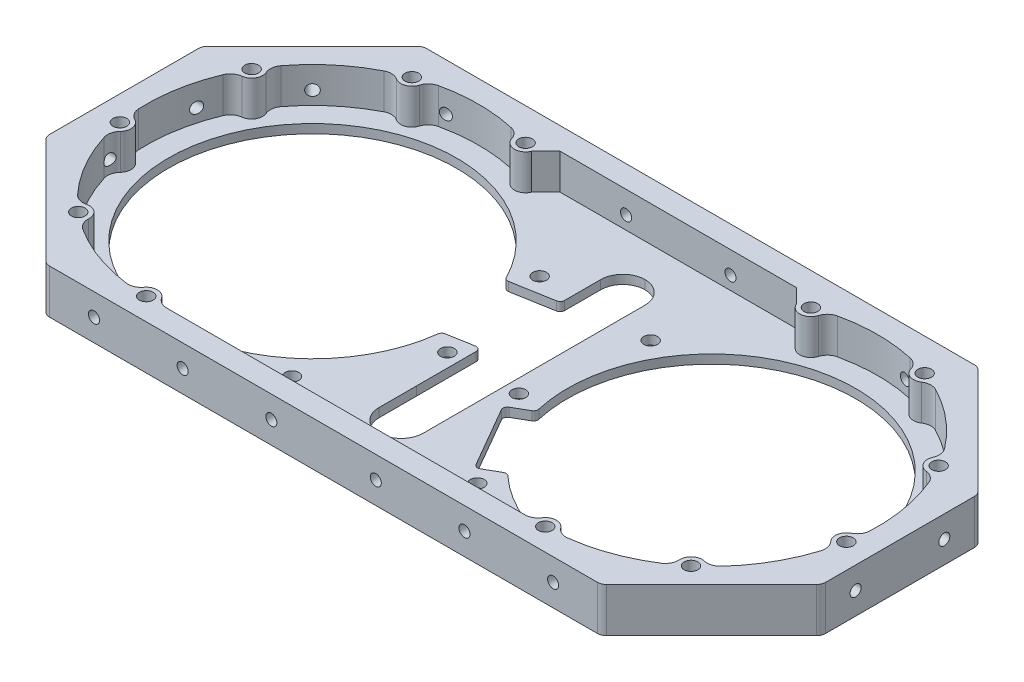
from build123d import *

# Parameters (mm, degrees)
SKETCH_2_R             = 1.55
SKETCH_2_R_2           = 1.550000002
SKETCH_2_R_3           = 1.550000001
EXTRUDE_3_DEPTH        = 10
SKETCH_2_8_W           = 10
SKETCH_2_8_H           = 60
SKETCH_2_8_R           = 1.55
SKETCH_2_8_R_2         = 1.550000002
SKETCH_2_8_R_3         = 1.550000001
SKETCH_2_8_R_4         = 32.5
EXTRUDE_4_DEPTH        = 2
CUT_EXTRUDE_1_DEPTH    = 12
FILLET_4_R             = 1
EXTRUDE_5_DEPTH        = 8
FILLET_5_R             = 3
FILLET_6_R             = 3
FILLET_7_R             = 2
HOLE_WIZARD_M3_1_D     = 2.5
HOLE_WIZARD_M3_1_DEPTH = 7.5
HOLE_WIZARD_M3_1_TIP   = 0.751075774
HOLE_WIZARD_M3_3_D     = 2.5
HOLE_WIZARD_M3_3_DEPTH = 8.5
HOLE_WIZARD_M3_3_TIP   = 0.751075774
HOLE_WIZARD_M3_4_D     = 2.5
HOLE_WIZARD_M3_4_DEPTH = 8.5
HOLE_WIZARD_M3_4_TIP   = 0.751075774
HOLE_WIZARD_M3_5_D     = 2.5
HOLE_WIZARD_M3_5_DEPTH = 8.5
HOLE_WIZARD_M3_5_TIP   = 0.751075774
FILLET_8_R             = 5
HOLE_WIZARD_M3_7_D     = 2.5
HOLE_WIZARD_M3_7_DEPTH = 8.5
HOLE_WIZARD_M3_7_TIP   = 0.751075774
HOLE_WIZARD_M3_8_D     = 2.5
HOLE_WIZARD_M3_8_DEPTH = 8.5
HOLE_WIZARD_M3_8_TIP   = 0.751075774


with BuildPart() as part:
    # 草图2 → 凸台-拉伸3 (new body)
    with BuildSketch(Plane(origin=(0, 0, 0), x_dir=(1, 0, 0), z_dir=(0, 1, 0))):
        Polygon((-17.604076401, 42.5), (-42.5, 17.604076401), (-42.5, -17.604076401), (-17.604076401, -42.5), (107.604076401, -42.5), (132.5, -17.604076401), (132.5, 17.604076401), (107.604076401, 42.5), align=None)
        with BuildLine():
            Line((15.145179759, 34.305590362), (20.839589397, 40))
            Line((20.839589397, 40), (69.160410606, 40))
            Line((69.160410606, 40), (74.854820243, 34.305590363))
            ThreePointArc((74.854820243, 34.305590363), (78.029294984, 32.889241728), (79.550672364, 36.014740759))
            ThreePointArc((79.550672364, 36.014740759), (90, 37.5), (100.449327636, 36.014740759))
            ThreePointArc((100.449327636, 36.014740759), (101.970705016, 32.889241728), (105.145179757, 34.305590363))
            ThreePointArc((105.145179757, 34.305590363), (114.104535363, 28.726666617), (121.154478496, 20.872193695))
            ThreePointArc((121.154478496, 20.872193695), (120.310889132, 17.5), (123.653089221, 16.544472971))
            ThreePointArc((123.653089221, 16.544472971), (126.930290738, 6.511806663), (127.282102624, -4.036684767))
            ThreePointArc((127.282102624, -4.036684767), (124.468271355, -6.077686218), (126.414344226, -8.957987195))
            ThreePointArc((126.414344226, -8.957987195), (122.475952642, -18.75), (115.965016591, -27.056753565))
            ThreePointArc((115.965016591, -27.056753565), (112.497566339, -26.811555509), (112.136922868, -30.268905596))
            ThreePointArc((112.136922868, -30.268905596), (102.825755375, -35.238473279), (92.498610725, -37.416666667))
            ThreePointArc((92.498610725, -37.416666667), (89.958327543, -35.000347343), (87.5, -37.5))
            Line((87.5, -37.5), (2.5, -37.5))
            ThreePointArc((2.5, -37.5), (0.041672457, -35.000347343), (-2.498610725, -37.416666667))
            ThreePointArc((-2.498610725, -37.416666667), (-12.825755375, -35.23847328), (-22.136922867, -30.268905596))
            ThreePointArc((-22.136922867, -30.268905596), (-22.497566338, -26.811555509), (-25.96501659, -27.056753565))
            ThreePointArc((-25.96501659, -27.056753565), (-32.475952642, -18.75), (-36.414344226, -8.957987195))
            ThreePointArc((-36.414344226, -8.957987195), (-34.468271354, -6.077686218), (-37.282102624, -4.036684767))
            ThreePointArc((-37.282102624, -4.036684767), (-36.930290738, 6.511806663), (-33.65308922, 16.544472972))
            ThreePointArc((-33.65308922, 16.544472972), (-30.31088913, 17.5), (-31.154478495, 20.872193696))
            ThreePointArc((-31.154478495, 20.872193696), (-24.104535362, 28.726666618), (-15.145179755, 34.305590363))
            ThreePointArc((-15.145179755, 34.305590363), (-11.970705014, 32.889241727), (-10.449327634, 36.01474076))
            ThreePointArc((-10.449327634, 36.01474076), (2e-09, 37.5), (10.449327638, 36.014740759))
            ThreePointArc((10.449327638, 36.014740759), (11.970705018, 32.889241726), (15.145179759, 34.305590362))
        make_face(mode=Mode.SUBTRACT)
        with Locations(Location((126.930290738, -6.511806663, 0), (0, 0, 270))):
            Circle(SKETCH_2_R, mode=Mode.SUBTRACT)
        with Locations(Location((122.475952642, 18.75, 0), (0, 0, 270))):
            Circle(SKETCH_2_R, mode=Mode.SUBTRACT)
        with Locations(Location((90, -37.5, 0), (0, 0, 270))):
            Circle(SKETCH_2_R, mode=Mode.SUBTRACT)
        with Locations(Location((-24.104535363, -28.726666616, 0), (0, 0, 270))):
            Circle(SKETCH_2_R, mode=Mode.SUBTRACT)
        with Locations(Location((0, -37.5, 0), (0, 0, 270))):
            Circle(SKETCH_2_R, mode=Mode.SUBTRACT)
        with Locations(Location((12.825755377, 35.238473278, 0), (0, 0, 270))):
            Circle(SKETCH_2_R_2, mode=Mode.SUBTRACT)
        with Locations(Location((-12.825755372, 35.238473279, 0), (0, 0, 270))):
            Circle(SKETCH_2_R_3, mode=Mode.SUBTRACT)
        with Locations(Location((-32.47595264, 18.75, 0), (0, 0, 270))):
            Circle(SKETCH_2_R, mode=Mode.SUBTRACT)
        with Locations(Location((77.174244625, 35.238473279, 0), (0, 0, 270))):
            Circle(SKETCH_2_R, mode=Mode.SUBTRACT)
        with Locations(Location((102.825755375, 35.238473279, 0), (0, 0, 270))):
            Circle(SKETCH_2_R, mode=Mode.SUBTRACT)
        with Locations(Location((-36.930290736, -6.511806662, 0), (0, 0, 270))):
            Circle(SKETCH_2_R, mode=Mode.SUBTRACT)
        with Locations(Location((114.104535363, -28.726666617, 0), (0, 0, 270))):
            Circle(SKETCH_2_R, mode=Mode.SUBTRACT)
    extrude(amount=EXTRUDE_3_DEPTH)

    # 草图2<8> → 凸台-拉伸4 (add)
    with BuildSketch(Plane(origin=(0, 0, 0), x_dir=(1, 0, 0), z_dir=(0, 1, 0))):
        with BuildLine():
            Line((20.839589397, 40), (15.145179759, 34.305590362))
            ThreePointArc((15.145179759, 34.305590362), (11.970705018, 32.889241726), (10.449327638, 36.014740759))
            ThreePointArc((10.449327638, 36.014740759), (2e-09, 37.5), (-10.449327634, 36.01474076))
            ThreePointArc((-10.449327634, 36.01474076), (-11.970705014, 32.889241727), (-15.145179755, 34.305590363))
            ThreePointArc((-15.145179755, 34.305590363), (-24.104535362, 28.726666618), (-31.154478495, 20.872193696))
            ThreePointArc((-31.154478495, 20.872193696), (-30.31088913, 17.5), (-33.65308922, 16.544472972))
            ThreePointArc((-33.65308922, 16.544472972), (-36.930290738, 6.511806663), (-37.282102624, -4.036684767))
            ThreePointArc((-37.282102624, -4.036684767), (-34.468271354, -6.077686218), (-36.414344226, -8.957987195))
            ThreePointArc((-36.414344226, -8.957987195), (-32.475952642, -18.75), (-25.96501659, -27.056753565))
            ThreePointArc((-25.96501659, -27.056753565), (-22.497566338, -26.811555509), (-22.136922867, -30.268905596))
            ThreePointArc((-22.136922867, -30.268905596), (-12.825755375, -35.23847328), (-2.498610725, -37.416666667))
            ThreePointArc((-2.498610725, -37.416666667), (0.041672457, -35.000347343), (2.5, -37.5))
            Line((2.5, -37.5), (87.5, -37.5))
            ThreePointArc((87.5, -37.5), (89.958327543, -35.000347343), (92.498610725, -37.416666667))
            ThreePointArc((92.498610725, -37.416666667), (102.825755375, -35.238473279), (112.136922868, -30.268905596))
            ThreePointArc((112.136922868, -30.268905596), (112.497566339, -26.811555509), (115.965016591, -27.056753565))
            ThreePointArc((115.965016591, -27.056753565), (122.475952642, -18.75), (126.414344226, -8.957987195))
            ThreePointArc((126.414344226, -8.957987195), (124.468271355, -6.077686218), (127.282102624, -4.036684767))
            ThreePointArc((127.282102624, -4.036684767), (126.930290738, 6.511806663), (123.653089221, 16.544472971))
            ThreePointArc((123.653089221, 16.544472971), (120.310889132, 17.5), (121.154478496, 20.872193695))
            ThreePointArc((121.154478496, 20.872193695), (114.104535363, 28.726666617), (105.145179757, 34.305590363))
            ThreePointArc((105.145179757, 34.305590363), (101.970705016, 32.889241728), (100.449327636, 36.014740759))
            ThreePointArc((100.449327636, 36.014740759), (90, 37.5), (79.550672364, 36.014740759))
            ThreePointArc((79.550672364, 36.014740759), (78.029294984, 32.889241728), (74.854820243, 34.305590363))
            Line((74.854820243, 34.305590363), (69.160410606, 40))
            Line((69.160410606, 40), (20.839589397, 40))
        make_face()
        with Locations((45, 0)):
            Rectangle(SKETCH_2_8_W, SKETCH_2_8_H, mode=Mode.SUBTRACT)
        with Locations(Location((65.895464637, -28.726666617, 0), (0, 0, 270))):
            Circle(SKETCH_2_8_R, mode=Mode.SUBTRACT)
        with Locations(Location((53.069709262, -6.511806663, 0), (0, 0, 270))):
            Circle(SKETCH_2_8_R, mode=Mode.SUBTRACT)
        with Locations(Location((57.524047358, 18.75, 0), (0, 0, 270))):
            Circle(SKETCH_2_8_R, mode=Mode.SUBTRACT)
        with Locations(Location((32.475952643, 18.749999998, 0), (0, 0, 270))):
            Circle(SKETCH_2_8_R_2, mode=Mode.SUBTRACT)
        with Locations(Location((36.930290738, -6.511806664, 0), (0, 0, 270))):
            Circle(SKETCH_2_8_R_2, mode=Mode.SUBTRACT)
        with Locations(Location((24.104535363, -28.726666618, 0), (0, 0, 270))):
            Circle(SKETCH_2_8_R_3, mode=Mode.SUBTRACT)
        with Locations(Location((0, 0, 0), (0, 0, 270))):
            Circle(SKETCH_2_8_R_4, mode=Mode.SUBTRACT)
        with Locations(Location((90, 0, 0), (0, 0, 270))):
            Circle(SKETCH_2_8_R_4, mode=Mode.SUBTRACT)
    extrude(amount=EXTRUDE_4_DEPTH)

    # 草图3 → 切除-拉伸1 (cut)
    with BuildSketch(Plane(origin=(0, 2, 0), x_dir=(1, 0, 0), z_dir=(0, 1, 0))):
        Polygon((37.762150046, -2.303420976), (34.696997373, 15.079923662), (26.818535348, 13.690738241), (29.883688022, -3.692606397), align=None)
        Polygon((60.655573116, -6.750908278), (53.727369886, -10.750908278), (62.553125261, -26.037565002), (69.481328491, -22.037565002), align=None)
        Polygon((40, 16.014986103), (34.696997373, 15.079923662), (37.762150046, -2.303420976), (40, -1.908827651), align=None)
        Polygon((42.575459397, 16.469109083), (40, 16.014986103), (40, -1.908827651), (45.640612071, -0.914235555), align=None)
    extrude(amount=-CUT_EXTRUDE_1_DEPTH, mode=Mode.SUBTRACT)

    # 圆角4
    fillet_4_edges = [part.edges().sort_by_distance(p)[0] for p in [
        (29.270913687, 1, -14.123158709),
        (32.336066361, 1, 3.260185929),
        (67.324743171, 1, 23.282670117),
        (58.498987797, 1, 7.996013392),
        (62.553125261, 1, 26.037565002),
        (53.727369886, 1, 10.750908278),
        (40, 1, -16.014986103),
        (40, 1, 1.908827651),
    ]]
    fillet(fillet_4_edges, radius=FILLET_4_R)

    # 草图4 → 凸台-拉伸5 (add)
    with BuildSketch(Plane(origin=(0, 2, 0), x_dir=(1, 0, 0), z_dir=(0, 1, 0))):
        Polygon((20.839589397, 40), (18.339589397, 37.5), (71.660410606, 37.5), (69.160410606, 40), align=None)
    extrude(amount=EXTRUDE_5_DEPTH)

    # 圆角5
    fillet_5_edges = [part.edges().sort_by_distance(p)[0] for p in [
        (92.498610725, 6, 37.416666667),
        (112.136922868, 6, 30.268905596),
        (115.965016591, 6, 27.056753565),
        (126.414344226, 6, 8.957987195),
        (127.282102624, 6, 4.036684767),
        (123.653089221, 6, -16.544472971),
        (121.154478496, 6, -20.872193695),
        (105.145179757, 6, -34.305590363),
        (100.449327636, 6, -36.014740759),
        (79.550672364, 6, -36.014740759),
        (10.449327638, 6, -36.014740759),
        (-10.449327634, 6, -36.01474076),
        (-15.145179755, 6, -34.305590363),
        (-31.154478495, 6, -20.872193696),
        (-33.65308922, 6, -16.544472972),
        (-37.282102624, 6, 4.036684767),
        (-36.414344226, 6, 8.957987195),
        (-25.96501659, 6, 27.056753565),
        (-22.136922867, 6, 30.268905596),
        (-2.498610725, 6, 37.416666667),
        (2.5, 6, 37.5),
    ]]
    fillet(fillet_5_edges, radius=FILLET_5_R)

    # 圆角6
    fillet_6_edges = [part.edges().sort_by_distance(p)[0] for p in [
        (87.5, 6, 37.5),
    ]]
    fillet(fillet_6_edges, radius=FILLET_6_R)

    # 圆角7
    fillet_7_edges = [part.edges().sort_by_distance(p)[0] for p in [
        (107.604076401, 5, -42.5),
        (132.5, 5, -17.604076401),
        (132.5, 5, 17.604076401),
        (107.604076401, 5, 42.5),
        (-17.604076401, 5, 42.5),
        (-42.5, 5, 17.604076401),
        (-42.5, 5, -17.604076401),
        (-17.604076401, 5, -42.5),
    ]]
    fillet(fillet_7_edges, radius=FILLET_7_R)

    # M3 螺纹孔1
    with Locations(Plane(origin=(0, 0, -42.5), x_dir=(-1, 0, 0), z_dir=(0, 0, -1))):
        with Locations((-96.775649276, 5), (-76.775649276, 5), (-56.775649276, 5), (-13.224350724, 5), (6.775649276, 5), (-33.224350724, 5)):
            Hole(HOLE_WIZARD_M3_1_D / 2, depth=HOLE_WIZARD_M3_1_DEPTH)
            with Locations((0, 0, -(HOLE_WIZARD_M3_1_DEPTH + HOLE_WIZARD_M3_1_TIP / 2))):  # 118° drill point
                Cone(0, HOLE_WIZARD_M3_1_D / 2, HOLE_WIZARD_M3_1_TIP, mode=Mode.SUBTRACT)

    # M3 螺纹孔3
    with Locations(Plane(origin=(-6.775649276, 5, 42.5), x_dir=(1, 0, 0), z_dir=(0, 0, 1))):
        with Locations((0, 0), (20, 0), (40, 0), (63.551298552, 0), (83.551298552, 0), (103.551298552, 0)):
            Hole(HOLE_WIZARD_M3_3_D / 2, depth=HOLE_WIZARD_M3_3_DEPTH)
            with Locations((0, 0, -(HOLE_WIZARD_M3_3_DEPTH + HOLE_WIZARD_M3_3_TIP / 2))):  # 118° drill point
                Cone(0, HOLE_WIZARD_M3_3_D / 2, HOLE_WIZARD_M3_3_TIP, mode=Mode.SUBTRACT)

    # M3 螺纹孔4
    with Locations(Plane(origin=(132.5, 5, 10), x_dir=(0, 0, 1), z_dir=(1, 0, 0))):
        with Locations((0, 0), (-20, 0)):
            Hole(HOLE_WIZARD_M3_4_D / 2, depth=HOLE_WIZARD_M3_4_DEPTH)
            with Locations((0, 0, -(HOLE_WIZARD_M3_4_DEPTH + HOLE_WIZARD_M3_4_TIP / 2))):  # 118° drill point
                Cone(0, HOLE_WIZARD_M3_4_D / 2, HOLE_WIZARD_M3_4_TIP, mode=Mode.SUBTRACT)

    # M3 螺纹孔5
    with Locations(Plane(origin=(-42.5, 5, -10), x_dir=(0, 0, -1), z_dir=(-1, 0, 0))):
        with Locations((0, 0), (-20, 0)):
            Hole(HOLE_WIZARD_M3_5_D / 2, depth=HOLE_WIZARD_M3_5_DEPTH)
            with Locations((0, 0, -(HOLE_WIZARD_M3_5_DEPTH + HOLE_WIZARD_M3_5_TIP / 2))):  # 118° drill point
                Cone(0, HOLE_WIZARD_M3_5_D / 2, HOLE_WIZARD_M3_5_TIP, mode=Mode.SUBTRACT)

    # 圆角8
    fillet_8_edges = [part.edges().sort_by_distance(p)[0] for p in [
        (40, 1, 30),
        (50, 1, 30),
        (50, 1, -30),
        (40, 1, -30),
    ]]
    fillet(fillet_8_edges, radius=FILLET_8_R - 0.0001)  # a hair under: the kernel refuses the full size

    # M3 螺纹孔7
    with Locations(Plane(origin=(-30.0520382, 5, -30.0520382), x_dir=(-0.707106781187, 0, 0.707106781187), z_dir=(-0.707106781187, 0, -0.707106781187))):
        with Locations((0, 0)):
            Hole(HOLE_WIZARD_M3_7_D / 2, depth=HOLE_WIZARD_M3_7_DEPTH)
            with Locations((0, 0, -(HOLE_WIZARD_M3_7_DEPTH + HOLE_WIZARD_M3_7_TIP / 2))):  # 118° drill point
                Cone(0, HOLE_WIZARD_M3_7_D / 2, HOLE_WIZARD_M3_7_TIP, mode=Mode.SUBTRACT)

    # M3 螺纹孔8
    with Locations(Plane(origin=(120.0520382, 5, -30.0520382), x_dir=(0.707106781187, 0, 0.707106781187), z_dir=(0.707106781187, 0, -0.707106781187))):
        with Locations((0, 0)):
            Hole(HOLE_WIZARD_M3_8_D / 2, depth=HOLE_WIZARD_M3_8_DEPTH)
            with Locations((0, 0, -(HOLE_WIZARD_M3_8_DEPTH + HOLE_WIZARD_M3_8_TIP / 2))):  # 118° drill point
                Cone(0, HOLE_WIZARD_M3_8_D / 2, HOLE_WIZARD_M3_8_TIP, mode=Mode.SUBTRACT)


solid = part.part
